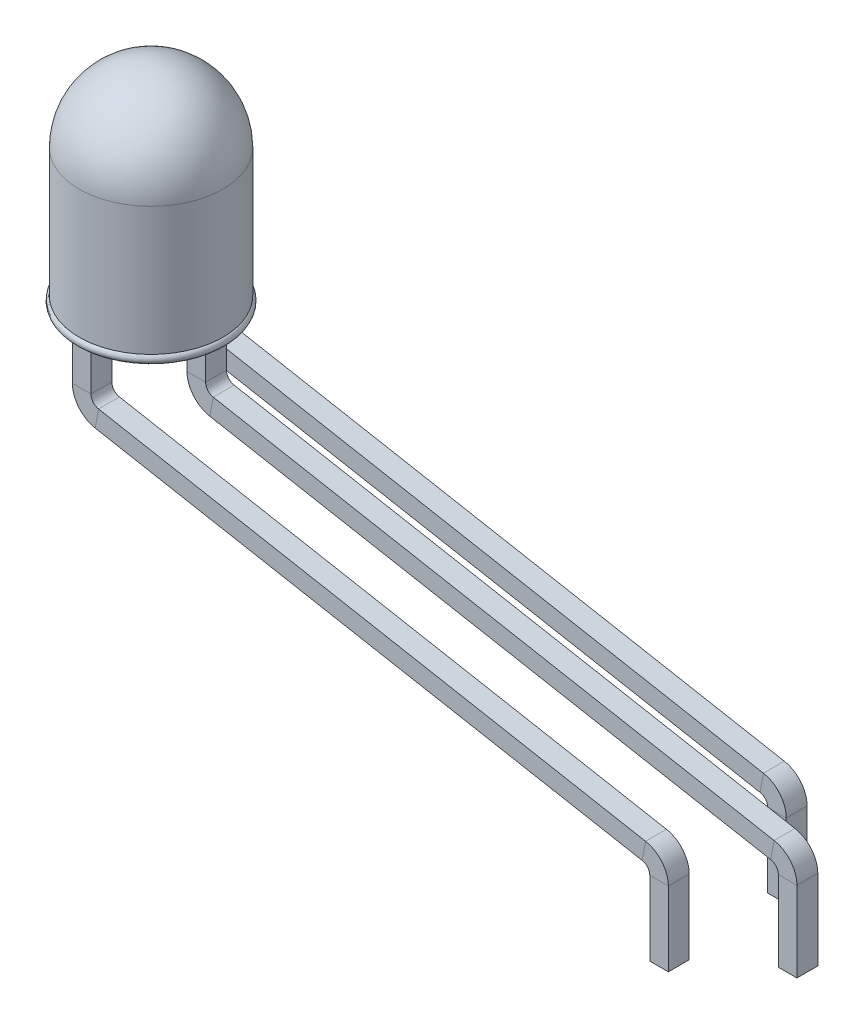
from build123d import *

# Parameters (mm, degrees)
SKETCH2_W = 0.4
SKETCH2_H = 0.45
SKETCH6_W = 0.4
SKETCH6_H = 0.45


with BuildPart() as part:
    # Sketch1 → Revolve1 (revolve)
    with BuildSketch(Plane.XY):
        with BuildLine():
            Line((0, 0), (-1.5, 0))
            ThreePointArc((-1.5, 0), (-1.596592583, 0.074118095), (-1.55, 0.18660254))
            Line((-1.55, 0.18660254), (-1.55, 2.95))
            ThreePointArc((-1.55, 2.95), (-1.096015511, 4.046015511), (0, 4.5))
            Line((0, 4.5), (0, 0))
        make_face()
    revolve(axis=Axis((0, 4.5, 0), (0, -1, 0)))

    # Sweep1: sweep along a path in Sketch4
    with BuildLine(Plane.XY) as sweep1_path:
        Line((0, 0), (0, -0.8))
        ThreePointArc((0, -0.8), (0.092564776, -1.055897602), (0.327417914, -1.193359684))
        Line((0.327417914, -1.193359684), (12.112582086, -3.367938908))
        ThreePointArc((12.112582086, -3.367938908), (12.347435224, -3.505400989), (12.44, -3.761298592))
        Line((12.44, -3.761298592), (12.44, -5.361298592))
    # Sketch2 → Sweep1 (sweep)
    with BuildSketch(Plane.XZ):
        with Locations((0, 1.27)):
            Rectangle(SKETCH2_W, SKETCH2_H)
        with Locations((0, -1.27)):
            Rectangle(SKETCH2_W, SKETCH2_H)
    sweep(path=sweep1_path.line)


with BuildPart() as body_2:
    # Sweep2: sweep along a path in Sketch7
    with BuildLine(Plane.XY) as sweep2_path:
        Line((1.2, 0), (1.2, -0.614669626))
        ThreePointArc((1.2, -0.614669626), (1.292564776, -0.870567229), (1.527417914, -1.00802931))
        Line((1.527417914, -1.00802931), (13.612582086, -3.237964044))
        ThreePointArc((13.612582086, -3.237964044), (13.847435224, -3.375426125), (13.94, -3.631323727))
        Line((13.94, -3.631323727), (13.94, -5.361298592))
    # Sketch6 → Sweep2 (sweep)
    with BuildSketch(Plane.XZ):
        with Locations((1.2, 0)):
            Rectangle(SKETCH6_W, SKETCH6_H)
    sweep(path=sweep2_path.line)


solid = Compound([part.part, body_2.part])
